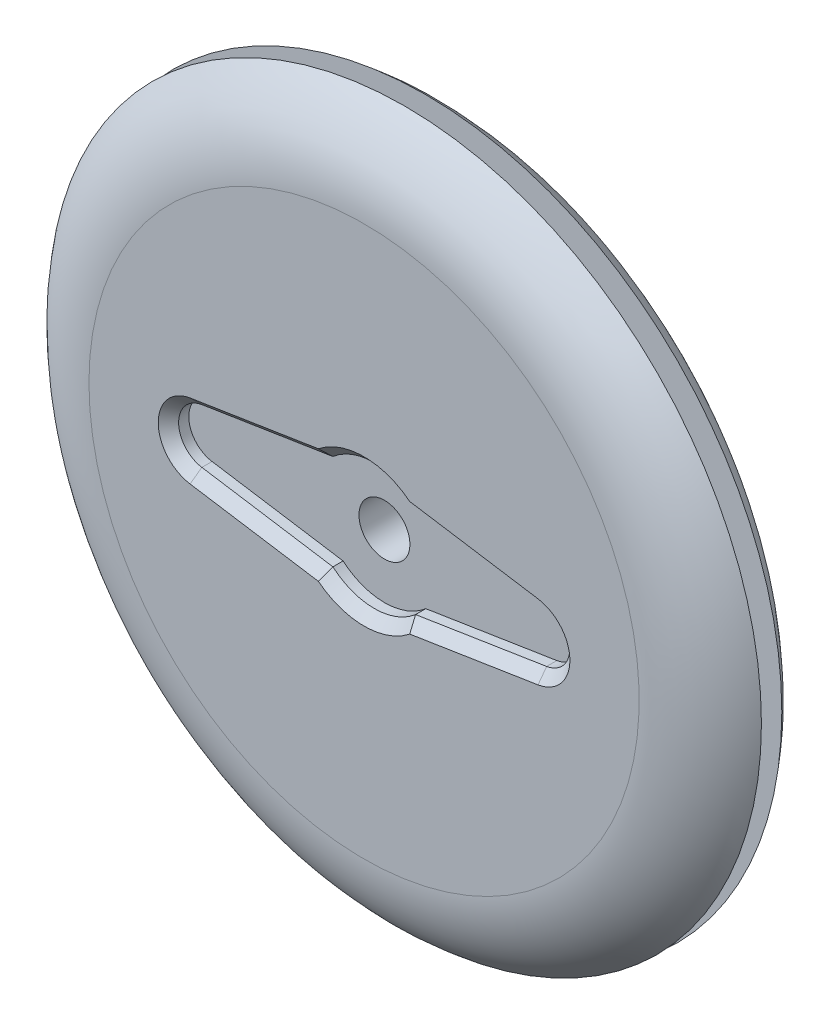
from build123d import *

# Parameters (mm, degrees)
SKETCH_1_R               = 1.5
EXTRUDE_1_DEPTH          = 2.3
SKETCH_2_R               = 4.4
EXTRUDE_2_DEPTH          = 3.2
SKETCH_3_R               = 4.4
SKETCH_3_R_2             = 3.4
SKETCH_3_R_3             = 2.75
SKETCH_3_R_4             = 1.5
CUT_EXTRUDE_1_DEPTH      = 1
BOSS_EXTRUDE1_DEPTH      = 2
BOSS_EXTRUDE1_DEPTH_BACK = 2
SKETCH1_R                = 35
INTERSECT2_OUTLINE_R     = 4.4
INTERSECT2_OUTLINE_R_2   = 3.4
INTERSECT2_OUTLINE_R_3   = 2.75
INTERSECT2_DEPTH         = 5.5
INTERSECT2_START         = 1
INTERSECT2_2_OUTLINE_R   = 4.4
INTERSECT2_2_OUTLINE_R_2 = 3.4
INTERSECT2_2_OUTLINE_R_3 = 2.75
INTERSECT2_2_OUTLINE_R_4 = 1.5
INTERSECT2_2_DEPTH       = 4.5
FILLET1_R                = 10
SKETCH2_R                = 25
BOSS_EXTRUDE2_DEPTH      = 2
SKETCH3_R                = 27
BOSS_EXTRUDE3_DEPTH      = 2
SKETCH4_R                = 6
CUT_EXTRUDE1_DEPTH       = 2
CUT_EXTRUDE3_REACH       = 52.14
SKETCH5_R                = 2.5
CUT_EXTRUDE4_START       = -2
CUT_EXTRUDE4_DEPTH       = 2
CHAMFER1_SIZE            = 1


# Read off the part's stored shape, not the designer's step: Intersect2
with BuildPart() as part:
    # Эскиз1 → Бобышка-Вытянуть1 (new body)
    with BuildSketch(Plane.XY):
        with BuildLine():
            Line((-3.968626967, 4.5), (-16.888114198, 2.469689731))
            ThreePointArc((-16.888114198, 2.469689731), (-19, 0), (-16.888114198, -2.469689731))
            Line((-16.888114198, -2.469689731), (-3.968626967, -4.5))
            ThreePointArc((-3.968626967, -4.5), (0, -6), (3.968626967, -4.5))
            Line((3.968626967, -4.5), (16.888114198, -2.469689731))
            ThreePointArc((16.888114198, -2.469689731), (19, 0), (16.888114198, 2.469689731))
            Line((16.888114198, 2.469689731), (3.968626967, 4.5))
            ThreePointArc((3.968626967, 4.5), (0, 6), (-3.968626967, 4.5))
        make_face()
        Circle(SKETCH_1_R, mode=Mode.SUBTRACT)
    extrude(amount=EXTRUDE_1_DEPTH)

    # Эскиз2 → Бобышка-Вытянуть2 (add)
    with BuildSketch(Plane.XY.offset(2.3)):
        with Locations(Location((0, 0, 0), (0, 0, 180))):
            Circle(SKETCH_2_R)
        Polygon((0.333439775, 2.639447604), (0, 3.05), (-0.333439775, 2.639447604), (-0.758504156, 2.954178641), (-0.979368078, 2.473601404), (-1.469348706, 2.672735374), (-1.563759083, 2.15232973), (-2.087868673, 2.223354314), (-2.049893354, 1.695819264), (-2.575200173, 1.634271725), (-2.407225286, 1.132754236), (-2.900722375, 0.942501833), (-2.6133024, 0.498514094), (-3.043981522, 0.191511085), (-2.655176114, -0.167049522), (-2.995976115, -0.571513009), (-2.530215347, -0.822116802), (-2.75972251, -1.298626839), (-2.246271844, -1.42552746), (-2.35006539, -1.944143169), (-1.821186821, -1.939366985), (-1.792745019, -2.467501833), (-1.281669931, -2.33134895), (-1.122779886, -2.835818282), (-0.661621006, -2.576843686), (-0.382266362, -3.025949839), (0, -2.660425857), (0.382266362, -3.025949839), (0.661621006, -2.576843686), (1.122779886, -2.835818282), (1.281669931, -2.33134895), (1.792745019, -2.467501833), (1.821186821, -1.939366985), (2.35006539, -1.944143169), (2.246271844, -1.42552746), (2.75972251, -1.298626839), (2.530215347, -0.822116802), (2.995976115, -0.571513009), (2.655176114, -0.167049522), (3.043981522, 0.191511085), (2.6133024, 0.498514094), (2.900722375, 0.942501833), (2.407225286, 1.132754236), (2.575200173, 1.634271725), (2.049893354, 1.695819264), (2.087868673, 2.223354314), (1.563759083, 2.15232973), (1.469348706, 2.672735374), (0.979368078, 2.473601404), (0.758504156, 2.954178641), align=None, mode=Mode.SUBTRACT)
    extrude(amount=EXTRUDE_2_DEPTH)

    # Эскиз3 → Вырез-Вытянуть1 (cut)
    # profile 1 of 2: a face of its own
    with BuildSketch(Plane(origin=(0, 0, 0), x_dir=(-1, 0, 0), z_dir=(0, 0, -1))):
        Circle(SKETCH_3_R)
        Circle(SKETCH_3_R_2, mode=Mode.SUBTRACT)
    # profile 2 of 2: a face of its own
    with BuildSketch(Plane(origin=(0, 0, 0), x_dir=(-1, 0, 0), z_dir=(0, 0, -1))):
        Circle(SKETCH_3_R_3)
        Circle(SKETCH_3_R_4, mode=Mode.SUBTRACT)
    extrude(amount=-CUT_EXTRUDE_1_DEPTH, mode=Mode.SUBTRACT)


with BuildPart() as body_2:
    # Sketch1 → Boss-Extrude1 (new, two sides: drawn at the far end of the back side and taken through both)
    with BuildSketch(Plane(origin=(0, 0, 0), x_dir=(-1, 0, 0), z_dir=(0, 0, -1)).offset(-BOSS_EXTRUDE1_DEPTH_BACK)):
        Circle(SKETCH1_R)
    extrude(amount=BOSS_EXTRUDE1_DEPTH + BOSS_EXTRUDE1_DEPTH_BACK)


with BuildPart() as intersect2_tool:
    # Intersect2 outline → Intersect2 (new body)
    # profile 1 of 2: a face of its own
    with BuildSketch(Plane.XY):
        with BuildLine():
            ThreePointArc((3.968626967, 4.5), (0, 6), (-3.968626967, 4.5))
            Line((-3.968626967, 4.5), (-16.888114198, 2.469689731))
            ThreePointArc((-16.888114198, 2.469689731), (-19, 0), (-16.888114198, -2.469689731))
            Line((-16.888114198, -2.469689731), (-3.968626967, -4.5))
            ThreePointArc((-3.968626967, -4.5), (0, -6), (3.968626967, -4.5))
            Line((3.968626967, -4.5), (16.888114198, -2.469689731))
            ThreePointArc((16.888114198, -2.469689731), (19, 0), (16.888114198, 2.469689731))
            Line((16.888114198, 2.469689731), (3.968626967, 4.5))
        make_face()
        Circle(INTERSECT2_OUTLINE_R, mode=Mode.SUBTRACT)
    # profile 2 of 2: a face of its own
    with BuildSketch(Plane.XY):
        Circle(INTERSECT2_OUTLINE_R_2)
        Circle(INTERSECT2_OUTLINE_R_3, mode=Mode.SUBTRACT)
    extrude(amount=INTERSECT2_DEPTH)


with BuildPart() as part_1:
    add(part.part)

    # Intersect2: cut by intersect2_tool
    add(intersect2_tool.part, mode=Mode.SUBTRACT)


with BuildPart() as body_2_1:
    add(body_2.part)

    # Intersect2: cut by intersect2_tool
    add(intersect2_tool.part, mode=Mode.SUBTRACT)


with BuildPart() as intersect2_2_tool:
    # Intersect2 2 outline → Intersect2 2 (new body)
    # profile 1 of 2: a face of its own
    with BuildSketch(Plane.XY.offset(INTERSECT2_START)):
        Circle(INTERSECT2_2_OUTLINE_R)
        Circle(INTERSECT2_2_OUTLINE_R_2, mode=Mode.SUBTRACT)
    # profile 2 of 2: a face of its own
    with BuildSketch(Plane.XY.offset(INTERSECT2_START)):
        Circle(INTERSECT2_2_OUTLINE_R_3)
        Circle(INTERSECT2_2_OUTLINE_R_4, mode=Mode.SUBTRACT)
    extrude(amount=INTERSECT2_2_DEPTH)


with BuildPart() as part_2:
    add(part_1.part)

    # Intersect2 2: cut by intersect2_2_tool
    add(intersect2_2_tool.part, mode=Mode.SUBTRACT)


with BuildPart() as body_2_2:
    add(body_2_1.part)

    # Intersect2 2: cut by intersect2_2_tool
    add(intersect2_2_tool.part, mode=Mode.SUBTRACT)

    # Fillet1
    # the kernel refuses this fillet: 10 mm, written as the material it takes off along each edge
    with BuildSketch(Plane(origin=(0, 0, 2), x_dir=(-1, 0, 0), z_dir=(0, -1, 0))) as fillet1_piece_1:
        with BuildLine():
            CenterArc((27, 10), FILLET1_R, 270, 53.130102354)
            Line((27, 0), (27, -0.2))
            Line((27, -0.2), (35, -0.2))
            Line((35, -0.2), (35.2, 0))
            ThreePointArc((35.2, 0), (35.2, 2), (35.16, 3.88))
            Line((35.16, 3.88), (35, 4))
        make_face()
    revolve(axis=Axis((0, 0, 2), (0, 0, -1)), mode=Mode.SUBTRACT)


with BuildPart() as body_2_2_1:
    # Mirror9: mirrored copy
    add(body_2_2.part.mirror(Plane.XY.offset(-3)))


with BuildPart() as body_2_3:
    add(body_2_2.part)

    add(body_2_2_1.part)  # Boss-Extrude2 merges body 2 2
    # Sketch2 → Boss-Extrude2 (add)
    with BuildSketch(Plane(origin=(0, 0, -2), x_dir=(-1, 0, 0), z_dir=(0, 0, -1))):
        Circle(SKETCH2_R)
    extrude(amount=BOSS_EXTRUDE2_DEPTH)

    # Sketch3 → Boss-Extrude3 (add)
    with BuildSketch(Plane(origin=(0, 0, -8), x_dir=(-1, 0, 0), z_dir=(0, 0, -1))):
        Circle(SKETCH3_R)
    extrude(amount=-BOSS_EXTRUDE3_DEPTH)

    # Sketch4 → Cut-Extrude1 (cut)
    with BuildSketch(Plane.XY):
        Circle(SKETCH4_R)
    extrude(amount=CUT_EXTRUDE1_DEPTH, mode=Mode.SUBTRACT)

    # Sketch5 → Cut-Extrude3 (cut, up to next)
    with BuildSketch(Plane.XY, mode=Mode.PRIVATE) as cut_extrude3_sk1:
        Circle(SKETCH5_R)
    cut_extrude3_tool1 = extrude(cut_extrude3_sk1.sketch, amount=-CUT_EXTRUDE3_REACH, mode=Mode.PRIVATE) & body_2_3.part
    add(cut_extrude3_tool1.solids().sort_by_distance((0, 0, 0))[0], mode=Mode.SUBTRACT)

    # Sketch6 → Cut-Extrude4 (cut)
    with BuildSketch(Plane.XY.offset(2).offset(CUT_EXTRUDE4_START)):
        with BuildLine():
            Line((16.919163334, 2.66726491), (4.056712891, 4.68861179))
            ThreePointArc((4.056712891, 4.68861179), (0, 6.2), (-4.056712891, 4.68861179))
            Line((-4.056712891, 4.68861179), (-16.919163334, 2.66726491))
            ThreePointArc((-16.919163334, 2.66726491), (-19.2, 0), (-16.919163334, -2.66726491))
            Line((-16.919163334, -2.66726491), (-4.056712891, -4.68861179))
            ThreePointArc((-4.056712891, -4.68861179), (0, -6.2), (4.056712891, -4.68861179))
            Line((4.056712891, -4.68861179), (16.919163334, -2.66726491))
            ThreePointArc((16.919163334, -2.66726491), (19.2, 0), (16.919163334, 2.66726491))
        make_face()
    extrude(amount=CUT_EXTRUDE4_DEPTH, mode=Mode.SUBTRACT)

    # Chamfer1
    chamfer1_edges = [body_2_3.edges().sort_by_distance(p)[0] for p in [
        (0, 6.2, 2),
        (-10.487938112, 3.67793835, 2),
        (-19.2, 0, 2),
        (-10.487938112, -3.67793835, 2),
        (0, -6.2, 2),
        (10.487938112, -3.67793835, 2),
        (19.2, 0, 2),
        (10.487938112, 3.67793835, 2),
    ]]
    chamfer(chamfer1_edges, length=CHAMFER1_SIZE)


solid = body_2_3.part
